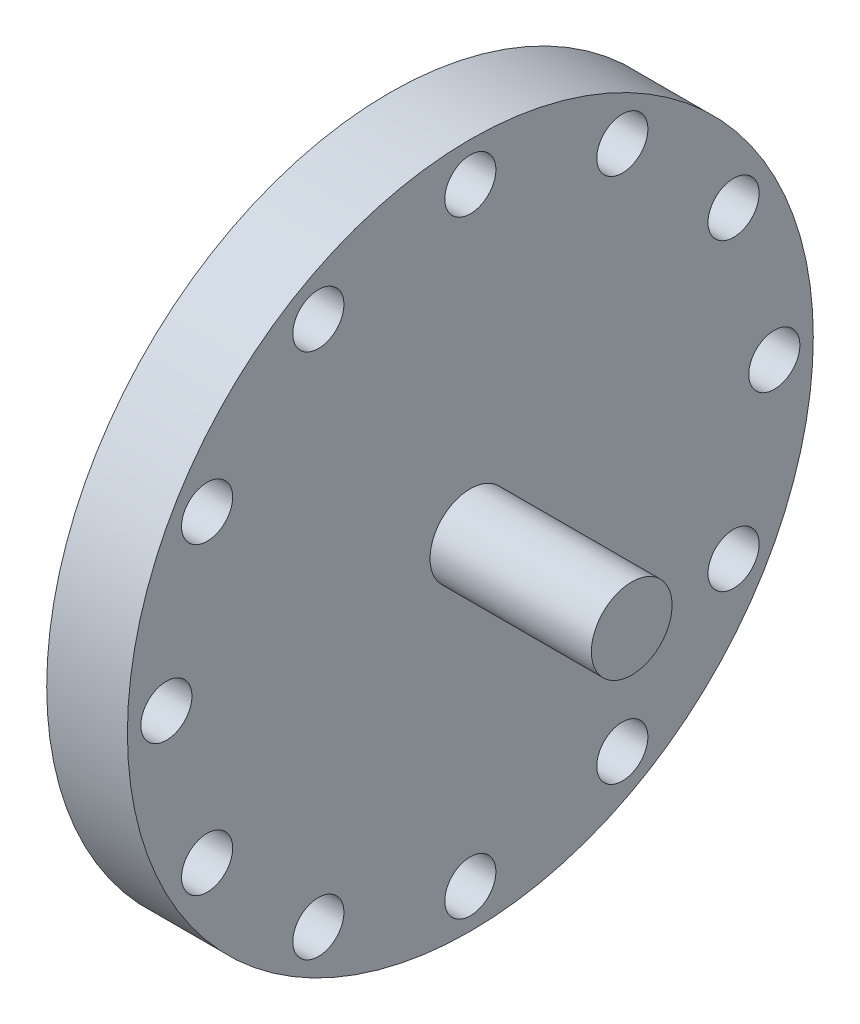
from build123d import *

# Parameters (mm, degrees)
SKETCH_2_R           = 4.25
CUT_EXTRUDE_1_DEPTH  = 20
THREAD_1_PITCH       = 1.5
SKETCH_5_R           = 9.5
CUT_EXTRUDE_2_DEPTH  = 207.185596005
SKETCH_6_R           = 9.5
CUT_EXTRUDE_3_DEPTH  = 207.185596005
SKETCH_7_R           = 9.5
CUT_EXTRUDE_4_DEPTH  = 207.185596005
SKETCH_8_R           = 9.5
CUT_EXTRUDE_5_DEPTH  = 207.185596005
SKETCH_9_R           = 9.5
CUT_EXTRUDE_6_DEPTH  = 207.185596005
SKETCH_10_R          = 9.5
CUT_EXTRUDE_7_DEPTH  = 207.185596005
SKETCH_11_R          = 9.5
CUT_EXTRUDE_8_DEPTH  = 207.185596005
SKETCH_12_R          = 9.5
CUT_EXTRUDE_9_DEPTH  = 207.185596005
SKETCH_13_R          = 9.5
CUT_EXTRUDE_10_DEPTH = 207.185596005
SKETCH_14_R          = 9.5
CUT_EXTRUDE_11_DEPTH = 207.185596005
SKETCH_15_R          = 9.5
CUT_EXTRUDE_12_DEPTH = 207.185596005
SKETCH_16_R          = 9.5
CUT_EXTRUDE_13_DEPTH = 207.185596005


with BuildPart() as part:
    # Sketch 1 → Повернуть1 (revolve)
    with BuildSketch(Plane.XY, mode=Mode.PRIVATE) as revolve_1_sk:
        Polygon((0, 0), (100, 0), (100, 15), (40, 15), (40, 127.5), (10, 127.5), (10, 20), (0, 20), align=None)
    revolve(revolve_1_sk.sketch.rotate(Axis((0, 0, 0), (1, 0, 0)), 90), axis=Axis((0, 0, 0), (1, 0, 0)))

    # Эскиз2 → Вырез-Вытянуть1 (cut)
    with BuildSketch(Plane(origin=(0, 0, 0), x_dir=(0, 0, -1), z_dir=(1, 0, 0))):
        Circle(SKETCH_2_R)
    extrude(amount=CUT_EXTRUDE_1_DEPTH, mode=Mode.SUBTRACT)

    # Резьба1: the profile of Sketch 1 2 profile screwed along a right-hand helix of 13.333333 turns, 8 arcs to a turn; built about Z, then put on its axis
    thread_1_z = Axis((0, 0, 0), (0, 0, 1))
    thread_1_corners = [(4.2497, 0, -0.000173205), (5.061898812, 0, 0.468749998), (5.061898812, 0, 0.656249998), (4.2497, 0, 1.125173201)]
    with BuildLine(mode=Mode.PRIVATE) as thread_1_profile:
        Line(thread_1_corners[0], thread_1_corners[1])
        Line(thread_1_corners[1], thread_1_corners[2])
        Line(thread_1_corners[2], thread_1_corners[3])
        Line(thread_1_corners[3], thread_1_corners[0])
    thread_1_cap = Face(thread_1_profile.wire())
    thread_1_turn_angles = [0, 22.5, 45, 67.5, 90, 112.5, 135, 157.5, 180, 202.5, 225, 247.5, 270, 292.5, 315, 337.5, 360]
    thread_1_turn_weights = [1, 0.9238795325112867, 1, 0.9238795325112867, 1, 0.9238795325112867, 1, 0.9238795325112867, 1, 0.9238795325112867, 1, 0.9238795325112867, 1, 0.9238795325112867, 1, 0.9238795325112867, 1]
    thread_1_turn_rails = [Edge.make_bspline([Vector(p[0], p[1], 0).rotate(thread_1_z, thread_1_turn_angles[k]) / thread_1_turn_weights[k] + Vector(0, 0, p[2] + THREAD_1_PITCH * thread_1_turn_angles[k] / 360) for k in range(17)], [0, 0, 0, 1, 1, 2, 2, 3, 3, 4, 4, 5, 5, 6, 6, 7, 7, 8, 8, 8], 2, thread_1_turn_weights) for p in thread_1_corners]
    thread_1_turn_sides = [Face.make_surface_from_curves(thread_1_turn_rails[p[0]], thread_1_turn_rails[p[1]]) for p in [(0, 1), (1, 2), (2, 3), (3, 0)]]
    thread_1_last_angles = [4680, 4702.5, 4725, 4747.5, 4770, 4785, 4800]
    thread_1_last_weights = [1, 0.9238795325112867, 1, 0.9238795325112867, 1, 0.9659258262890703, 1]
    thread_1_last_rails = [Edge.make_bspline([Vector(p[0], p[1], 0).rotate(thread_1_z, thread_1_last_angles[k]) / thread_1_last_weights[k] + Vector(0, 0, p[2] + THREAD_1_PITCH * thread_1_last_angles[k] / 360) for k in range(7)], [0, 0, 0, 1, 1, 2, 2, 3, 3, 3], 2, thread_1_last_weights) for p in thread_1_corners]
    thread_1_last_sides = [Face.make_surface_from_curves(thread_1_last_rails[p[0]], thread_1_last_rails[p[1]]) for p in [(0, 1), (1, 2), (2, 3), (3, 0)]]
    thread_1 = Plane(origin=(0, 0, 0), x_dir=(0, 0, -1), z_dir=(1, 0, 0)) * Solid(Shell([*[p.moved(Location((0, 0, THREAD_1_PITCH * i))) for i in range(13) for p in thread_1_turn_sides], *thread_1_last_sides, thread_1_cap, thread_1_cap.rotate(thread_1_z, 4800).moved(Location((0, 0, THREAD_1_PITCH * 4800 / 360)))]))
    add(thread_1, mode=Mode.SUBTRACT)

    # Эскиз5 → Вырез-Вытянуть2 (cut, through all)
    with BuildSketch(Plane(origin=(0, 0, 0), x_dir=(0, 0, -1), z_dir=(1, 0, 0))):
        with Locations(Location((0, 113, 0), (0, 0, 180))):
            Circle(SKETCH_5_R)
    extrude(amount=CUT_EXTRUDE_2_DEPTH, mode=Mode.SUBTRACT)

    # Эскиз6 → Вырез-Вытянуть3 (cut, through all)
    with BuildSketch(Plane(origin=(0, 0, 0), x_dir=(0, 0, -1), z_dir=(1, 0, 0))):
        with Locations(Location((-56.5, 97.860870628, 0), (0, 0, 180))):
            Circle(SKETCH_6_R)
    extrude(amount=CUT_EXTRUDE_3_DEPTH, mode=Mode.SUBTRACT)

    # Эскиз7 → Вырез-Вытянуть4 (cut, through all)
    with BuildSketch(Plane(origin=(0, 0, 0), x_dir=(0, 0, -1), z_dir=(1, 0, 0))):
        with Locations(Location((-97.860870628, 56.5, 0), (0, 0, 180))):
            Circle(SKETCH_7_R)
    extrude(amount=CUT_EXTRUDE_4_DEPTH, mode=Mode.SUBTRACT)

    # Эскиз8 → Вырез-Вытянуть5 (cut, through all)
    with BuildSketch(Plane(origin=(0, 0, 0), x_dir=(0, 0, -1), z_dir=(1, 0, 0))):
        with Locations(Location((-113, 0, 0), (0, 0, 180))):
            Circle(SKETCH_8_R)
    extrude(amount=CUT_EXTRUDE_5_DEPTH, mode=Mode.SUBTRACT)

    # Эскиз9 → Вырез-Вытянуть6 (cut, through all)
    with BuildSketch(Plane(origin=(0, 0, 0), x_dir=(0, 0, -1), z_dir=(1, 0, 0))):
        with Locations(Location((-97.860870628, -56.5, 0), (0, 0, 180))):
            Circle(SKETCH_9_R)
    extrude(amount=CUT_EXTRUDE_6_DEPTH, mode=Mode.SUBTRACT)

    # Эскиз10 → Вырез-Вытянуть7 (cut, through all)
    with BuildSketch(Plane(origin=(0, 0, 0), x_dir=(0, 0, -1), z_dir=(1, 0, 0))):
        with Locations(Location((-56.5, -97.860870628, 0), (0, 0, 180))):
            Circle(SKETCH_10_R)
    extrude(amount=CUT_EXTRUDE_7_DEPTH, mode=Mode.SUBTRACT)

    # Эскиз11 → Вырез-Вытянуть8 (cut, through all)
    with BuildSketch(Plane(origin=(0, 0, 0), x_dir=(0, 0, -1), z_dir=(1, 0, 0))):
        with Locations(Location((0, -113, 0), (0, 0, 180))):
            Circle(SKETCH_11_R)
    extrude(amount=CUT_EXTRUDE_8_DEPTH, mode=Mode.SUBTRACT)

    # Эскиз12 → Вырез-Вытянуть9 (cut, through all)
    with BuildSketch(Plane(origin=(0, 0, 0), x_dir=(0, 0, -1), z_dir=(1, 0, 0))):
        with Locations(Location((56.5, -97.860870628, 0), (0, 0, 180))):
            Circle(SKETCH_12_R)
    extrude(amount=CUT_EXTRUDE_9_DEPTH, mode=Mode.SUBTRACT)

    # Эскиз13 → Вырез-Вытянуть10 (cut, through all)
    with BuildSketch(Plane(origin=(0, 0, 0), x_dir=(0, 0, -1), z_dir=(1, 0, 0))):
        with Locations(Location((97.860870628, -56.5, 0), (0, 0, 180))):
            Circle(SKETCH_13_R)
    extrude(amount=CUT_EXTRUDE_10_DEPTH, mode=Mode.SUBTRACT)

    # Эскиз14 → Вырез-Вытянуть11 (cut, through all)
    with BuildSketch(Plane(origin=(0, 0, 0), x_dir=(0, 0, -1), z_dir=(1, 0, 0))):
        with Locations(Location((113, 0, 0), (0, 0, 180))):
            Circle(SKETCH_14_R)
    extrude(amount=CUT_EXTRUDE_11_DEPTH, mode=Mode.SUBTRACT)

    # Эскиз15 → Вырез-Вытянуть12 (cut, through all)
    with BuildSketch(Plane(origin=(0, 0, 0), x_dir=(0, 0, -1), z_dir=(1, 0, 0))):
        with Locations(Location((97.860870628, 56.5, 0), (0, 0, 180))):
            Circle(SKETCH_15_R)
    extrude(amount=CUT_EXTRUDE_12_DEPTH, mode=Mode.SUBTRACT)

    # Эскиз16 → Вырез-Вытянуть13 (cut, through all)
    with BuildSketch(Plane(origin=(0, 0, 0), x_dir=(0, 0, -1), z_dir=(1, 0, 0))):
        with Locations(Location((56.5, 97.860870628, 0), (0, 0, 180))):
            Circle(SKETCH_16_R)
    extrude(amount=CUT_EXTRUDE_13_DEPTH, mode=Mode.SUBTRACT)


solid = part.part
